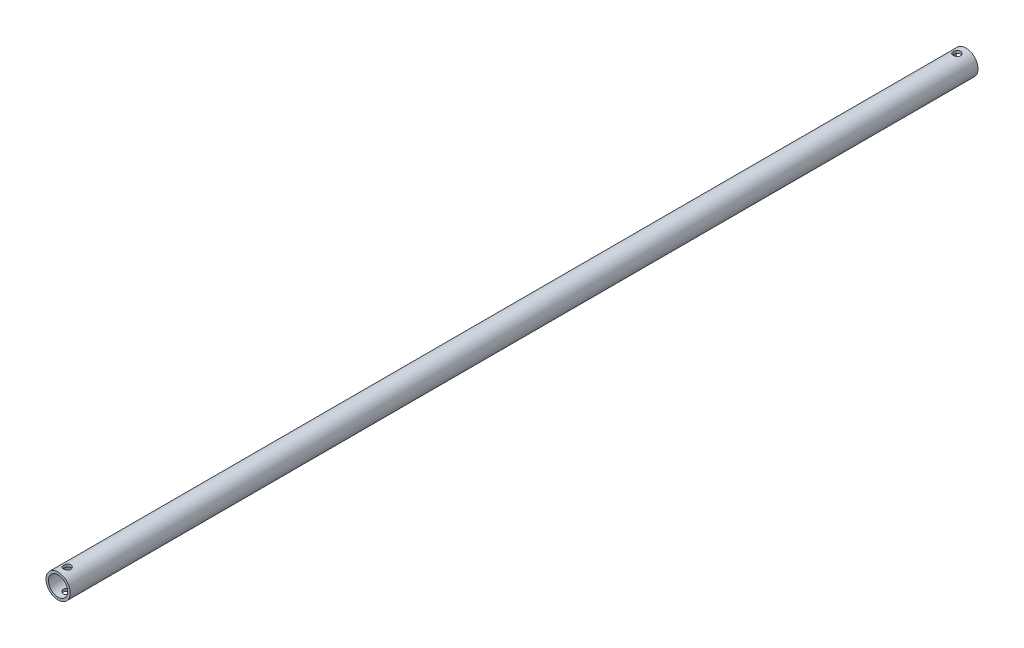
from build123d import *

# Parameters (mm, degrees)
SZKIC1_R                    = 10
DODANIE_WYCI_GNI_CIE2_DEPTH = 750
SZKIC3_R                    = 8
WYTNIJ_WYCI_GNI_CIE1_DEPTH  = 751.133321484
SZKIC4_R                    = 3
WYTNIJ_WYCI_GNI_CIE2_DEPTH  = 751.133321484


with BuildPart() as part:
    # Szkic1 → Dodanie-wyciągnięcie2 (new body)
    with BuildSketch(Plane.XY):
        Circle(SZKIC1_R)
    extrude(amount=DODANIE_WYCI_GNI_CIE2_DEPTH)

    # Szkic3 → Wytnij-wyciągnięcie1 (cut, through all)
    with BuildSketch(Plane.XY.offset(750)):
        Circle(SZKIC3_R)
    extrude(amount=-WYTNIJ_WYCI_GNI_CIE1_DEPTH, mode=Mode.SUBTRACT)

    # Szkic4 → Wytnij-wyciągnięcie2 (cut, symmetric)
    with BuildSketch(Plane(origin=(0, 0, 0), x_dir=(1, 0, 0), z_dir=(0, 1, 0))):
        with Locations((0, -7.5)):
            Circle(SZKIC4_R)
    wytnij_wyci_gni_cie2 = extrude(amount=WYTNIJ_WYCI_GNI_CIE2_DEPTH, both=True, mode=Mode.SUBTRACT)

    # Mirror1: Wytnij-wyciągnięcie2 across plane
    add(wytnij_wyci_gni_cie2.mirror(Plane.XY.offset(375)), mode=Mode.SUBTRACT)


solid = part.part
